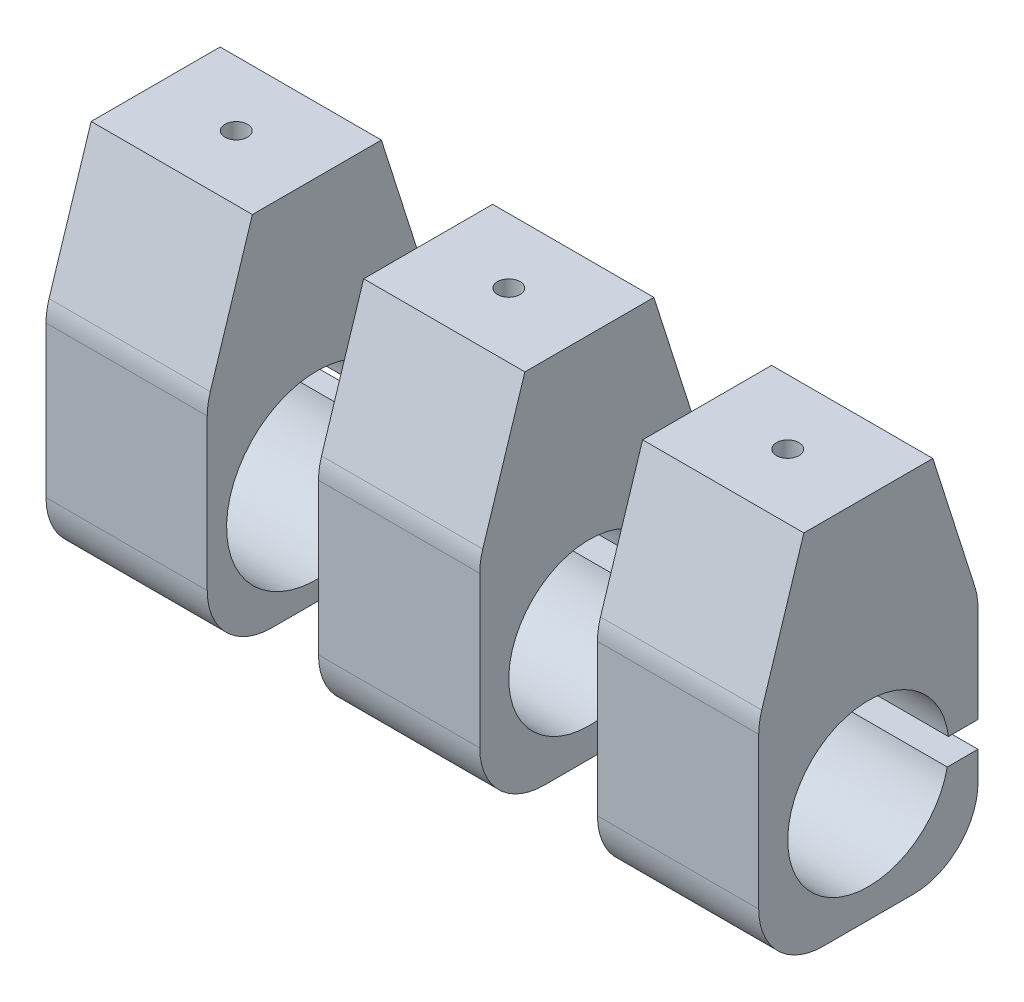
from build123d import *

# Parameters (mm, degrees)
ZOOM_LENSE_MOUNT_DEPTH = 25
SPEC_START             = 42.25
SPEC_MOUNT1_DEPTH      = 25
SPEC_START_2           = 85.5
SPEC_MOUNT_2_DEPTH     = 25
FILLET1_R              = 10
FILLET2_R              = 10
FILLET3_R              = 10
SKETCH2_R              = 1.75
CUT_EXTRUDE1_DEPTH     = 30
SKETCH3_R              = 1.75
CUT_EXTRUDE2_DEPTH     = 30
SKETCH4_R              = 1.75
CUT_EXTRUDE3_DEPTH     = 30


with BuildPart() as part:
    # Sketch1 → zoom lense mount (new body)
    with BuildSketch(Plane(origin=(0, 0, 0), x_dir=(0, 0, -1), z_dir=(1, 0, 0))):
        with BuildLine():
            Line((10, 40), (-10, 40))
            Line((-10, 40), (-17, 18))
            Line((-17, 18), (-17, -17))
            Line((-17, -17), (17, -17))
            Line((17, -17), (17, -2.55))
            Line((17, -2.55), (13.765809094, -2.55))
            ThreePointArc((13.765809094, -2.55), (-13.988966644, 0.555708769), (13.924708255, 1.45))
            Line((13.924708255, 1.45), (17, 1.45))
            Line((17, 1.45), (17, 18))
            Line((17, 18), (10, 40))
        make_face()
    extrude(amount=ZOOM_LENSE_MOUNT_DEPTH)

    # Fillet1
    fillet1_edges = [part.edges().sort_by_distance(p)[0] for p in [
        (12.5, -17, -17),
        (12.5, 18, -17),
        (12.5, -17, 17),
        (12.5, 18, 17),
    ]]
    fillet(fillet1_edges, radius=FILLET1_R)

    # Sketch4 → Cut-Extrude3 (cut)
    with BuildSketch(Plane(origin=(0, 40, 0), x_dir=(1, 0, 0), z_dir=(0, 1, 0))):
        with Locations((12.5, 0)):
            Circle(SKETCH4_R)
    extrude(amount=-CUT_EXTRUDE3_DEPTH, mode=Mode.SUBTRACT)


with BuildPart() as body_2:
    # Sketch1<4> → spec mount1 (new body)
    with BuildSketch(Plane(origin=(0, 0, 0), x_dir=(0, 0, -1), z_dir=(1, 0, 0)).offset(SPEC_START)):
        with BuildLine():
            Line((10, 40), (-10, 40))
            Line((-10, 40), (-17, 18))
            Line((-17, 18), (-17, -17))
            Line((-17, -17), (17, -17))
            Line((17, -17), (17, -2.55))
            Line((17, -2.55), (12.237136103, -2.55))
            ThreePointArc((12.237136103, -2.55), (-12.487575277, 0.55719269), (12.415615168, 1.45))
            Line((12.415615168, 1.45), (17, 1.45))
            Line((17, 1.45), (17, 18))
            Line((17, 18), (10, 40))
        make_face()
    extrude(amount=SPEC_MOUNT1_DEPTH)

    # Fillet2
    fillet2_edges = [body_2.edges().sort_by_distance(p)[0] for p in [
        (54.75, -17, -17),
        (54.75, 18, -17),
        (54.75, -17, 17),
        (54.75, 18, 17),
    ]]
    fillet(fillet2_edges, radius=FILLET2_R)

    # Sketch3 → Cut-Extrude2 (cut)
    with BuildSketch(Plane(origin=(0, 40, 0), x_dir=(1, 0, 0), z_dir=(0, 1, 0))):
        with Locations((54.75, 0)):
            Circle(SKETCH3_R)
    extrude(amount=-CUT_EXTRUDE2_DEPTH, mode=Mode.SUBTRACT)


with BuildPart() as body_3:
    # Sketch1<5> → spec mount 2 (new body)
    with BuildSketch(Plane(origin=(0, 0, 0), x_dir=(0, 0, -1), z_dir=(1, 0, 0)).offset(SPEC_START_2)):
        with BuildLine():
            Line((10, 40), (-10, 40))
            Line((-10, 40), (-17, 18))
            Line((-17, 18), (-17, -17))
            Line((-17, -17), (17, -17))
            Line((17, -17), (17, -2.55))
            Line((17, -2.55), (12.237136103, -2.55))
            ThreePointArc((12.237136103, -2.55), (-12.487575277, 0.55719269), (12.415615168, 1.45))
            Line((12.415615168, 1.45), (17, 1.45))
            Line((17, 1.45), (17, 18))
            Line((17, 18), (10, 40))
        make_face()
    extrude(amount=SPEC_MOUNT_2_DEPTH)

    # Fillet3
    fillet3_edges = [body_3.edges().sort_by_distance(p)[0] for p in [
        (98, -17, -17),
        (98, 18, -17),
        (98, -17, 17),
        (98, 18, 17),
    ]]
    fillet(fillet3_edges, radius=FILLET3_R)

    # Sketch2 → Cut-Extrude1 (cut)
    with BuildSketch(Plane(origin=(0, 40, 0), x_dir=(1, 0, 0), z_dir=(0, 1, 0))):
        with Locations((98, 0)):
            Circle(SKETCH2_R)
    extrude(amount=-CUT_EXTRUDE1_DEPTH, mode=Mode.SUBTRACT)


solid = Compound([part.part, body_2.part, body_3.part])
